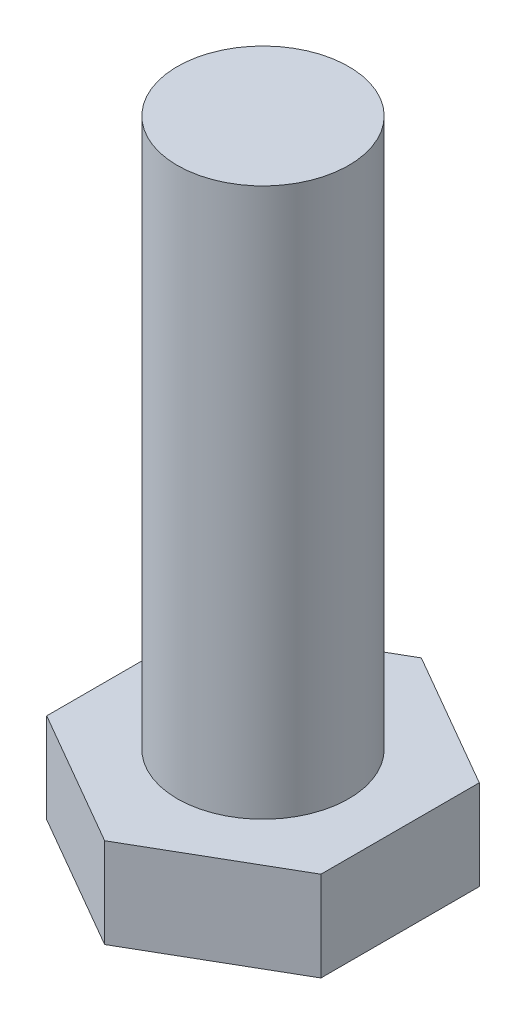
from build123d import *

# Parameters (mm, degrees)
EXTRUDE_1_DEPTH = 3.2
SKETCH_2_R      = 2.5
EXTRUDE_2_DEPTH = 16
CHAMFER_1_SIZE  = 1
CHAMFER_1_SIZE2 = 0.577350269


with BuildPart() as part:
    # Эскиз1 → Бобышка-Вытянуть1 (new body)
    with BuildSketch(Plane(origin=(0, 0, 0), x_dir=(1, 0, 0), z_dir=(0, 1, 0))):
        Polygon((4, -2.309401077), (4, 2.309401077), (0, 4.618802154), (-4, 2.309401077), (-4, -2.309401077), (0, -4.618802154), align=None)
    extrude(amount=EXTRUDE_1_DEPTH)

    # Эскиз2 → Бобышка-Вытянуть2 (add)
    with BuildSketch(Plane(origin=(0, 3.2, 0), x_dir=(1, 0, 0), z_dir=(0, 1, 0))):
        Circle(SKETCH_2_R)
    extrude(amount=EXTRUDE_2_DEPTH)

    # Фаска1
    chamfer_1_edges = [part.edges().sort_by_distance(p)[0] for p in [
        (2, 0, -3.464101615),
        (4, 0, 0),
        (2, 0, 3.464101615),
        (-2, 0, 3.464101615),
        (-4, 0, 0),
        (-2, 0, -3.464101615),
    ]]
    chamfer_1_side = [part.faces().sort_by_distance(p)[0] for p in [
        (0, 0, 0),
    ]]
    chamfer(chamfer_1_edges, length=CHAMFER_1_SIZE, length2=CHAMFER_1_SIZE2, reference=chamfer_1_side[0])


solid = part.part
